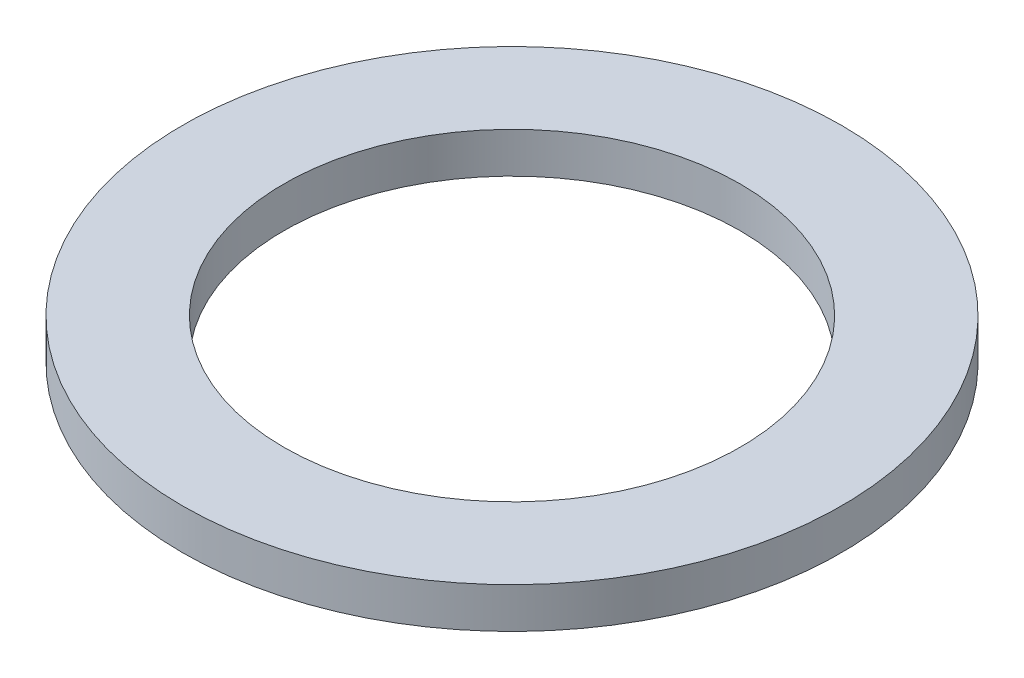
from build123d import *

# Parameters (mm, degrees)
SKETCH1_R           = 32.5
BOSS_EXTRUDE1_DEPTH = 4
SKETCH2_R           = 22.5
CUT_EXTRUDE1_DEPTH  = 47.135669498


with BuildPart() as part:
    # Sketch1 → Boss-Extrude1 (new body)
    with BuildSketch(Plane(origin=(0, 0, 0), x_dir=(1, 0, 0), z_dir=(0, 1, 0))):
        Circle(SKETCH1_R)
    extrude(amount=BOSS_EXTRUDE1_DEPTH)

    # Sketch2 → Cut-Extrude1 (cut, through all)
    with BuildSketch(Plane(origin=(0, 0, 0), x_dir=(1, 0, 0), z_dir=(0, 1, 0))):
        Circle(SKETCH2_R)
    extrude(amount=CUT_EXTRUDE1_DEPTH, mode=Mode.SUBTRACT)


solid = part.part
